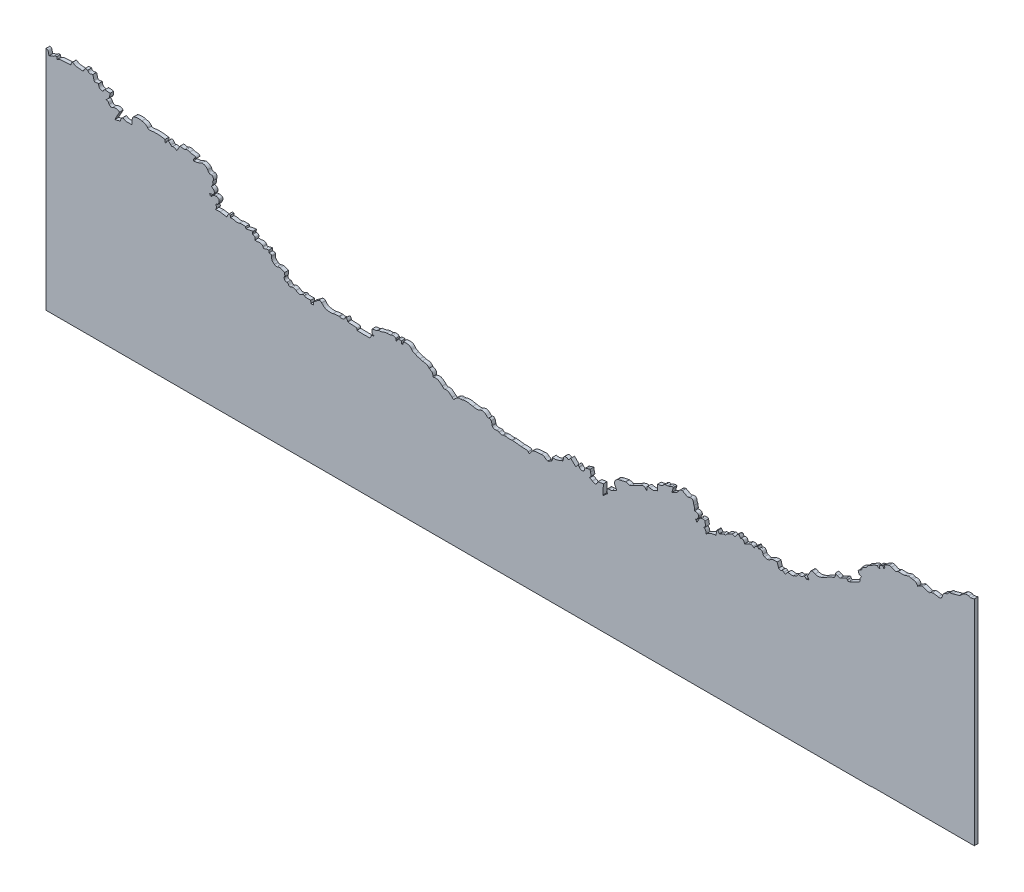
from build123d import *

# Parameters (mm, degrees)
BOSS_EXTRUDE1_DEPTH = 4.7625
SCALE1_SCALE        = 1.25


with BuildPart() as part:
    # Sketch3 → Boss-Extrude1 (new body)
    with BuildSketch(Plane.XY):
        with BuildLine():
            add(Edge.make_bspline(
                [(725.851610967, -198.417629607), (727.334452099, -198.296691726), (728.7855087, -197.784893222), (730.25, -197.439226226)],
                knots=[341, 341, 341, 341, 342, 342, 342, 342], degree=3))
            add(Edge.make_bspline(
                [(730.25, -197.439226226), (730.25, -288.109529826), (730.25, -378.779835131), (730.25, -469.450133611)],
                knots=[0, 0, 0, 0, 1, 1, 1, 1], degree=3))
            add(Edge.make_bspline(
                [(730.25, -469.450133611), (687.377366721, -469.447402981), (644.504624218, -469.442597073), (601.631990939, -469.460919598)],
                knots=[1, 1, 1, 1, 2, 2, 2, 2], degree=3))
            add(Edge.make_bspline(
                [(601.631990939, -469.460919598), (600.95894534, -469.461219967), (600.286118192, -469.745669659), (599.613181818, -469.897519974)],
                knots=[2, 2, 2, 2, 3, 3, 3, 3], degree=3))
            add(Edge.make_bspline(
                [(599.613181818, -469.897519974), (249.458806083, -469.897519974), (-100.695596959, -469.897519974), (-450.849999947, -469.897519974)],
                knots=[3, 3, 3, 3, 4, 4, 4, 4], degree=3))
            add(Edge.make_bspline(
                [(-450.849999947, -469.897519974), (-450.85, -373.709451792), (-450.85, -277.521383611), (-450.85, -181.333315429)],
                knots=[4, 4, 4, 4, 5, 5, 5, 5], degree=3))
            add(Edge.make_bspline(
                [(-450.85, -181.333315429), (-446.851454509, -181.678541684), (-448.116753841, -185.412180685), (-446.995952604, -187.571968802)],
                knots=[5, 5, 5, 5, 6, 6, 6, 6], degree=3))
            add(Edge.make_bspline(
                [(-446.995952604, -187.571968802), (-444.647646935, -185.916783126), (-441.480241967, -186.235297423), (-439.580115397, -183.847361358), (-439.22054011, -183.395474149), (-437.963206323, -183.657951232), (-437.150122089, -183.593198189)],
                knots=[6, 6, 6, 6, 7, 7, 7, 8, 8, 8, 8], degree=3))
            add(Edge.make_bspline(
                [(-437.150122089, -183.593198189), (-436.985577759, -184.749369401), (-436.857178432, -185.651568161), (-436.709741497, -186.687528095)],
                knots=[8, 8, 8, 8, 9, 9, 9, 9], degree=3))
            add(Edge.make_bspline(
                [(-436.709741497, -186.687528095), (-435.054898004, -185.854931805), (-433.730114251, -184.704758592), (-432.304223814, -184.561596372), (-428.011624495, -184.130609146), (-423.679654616, -184.091722847), (-419.418585535, -183.902377999)],
                knots=[9, 9, 9, 9, 10, 10, 10, 11, 11, 11, 11], degree=3))
            add(Edge.make_bspline(
                [(-419.418585535, -183.902377999), (-419.065112352, -182.82868375), (-418.852921948, -182.148742885), (-418.617746468, -181.47684671), (-418.049557049, -179.85352183), (-416.448012033, -179.286698258), (-415.282203832, -180.538390522), (-413.845906284, -182.080494636), (-412.189851073, -182.292094969), (-410.277051822, -182.268728885), (-408.827951034, -182.251027152), (-407.349263874, -182.404904533), (-405.930664219, -182.704552312), (-404.113338021, -183.088422523), (-403.041248443, -182.581793016), (-402.494101938, -180.748965161), (-402.266671207, -179.987111699), (-401.636916328, -179.34536253), (-401.190113636, -178.6489973)],
                knots=[11, 11, 11, 11, 12, 12, 12, 13, 13, 13, 14, 14, 14, 15, 15, 15, 16, 16, 16, 17, 17, 17, 17], degree=3))
            add(Edge.make_bspline(
                [(-401.190113636, -178.6489973), (-399.997084471, -178.648997247), (-398.804051893, -178.648997247), (-397.611022727, -178.648997247)],
                knots=[17, 17, 17, 17, 18, 18, 18, 18], degree=3))
            add(Edge.make_bspline(
                [(-397.611022727, -178.648997247), (-396.418273451, -182.500564463), (-393.56004488, -180.925666127), (-391.261551016, -180.321114746)],
                knots=[18, 18, 18, 18, 19, 19, 19, 19], degree=3))
            add(Edge.make_bspline(
                [(-391.261551016, -180.321114746), (-390.623239026, -182.690028776), (-390.153208916, -184.737976702), (-389.467431757, -186.710926177), (-389.337788287, -187.08390459), (-388.327687416, -187.38323536), (-387.763819218, -187.325583234), (-386.503838426, -187.196758954), (-385.269061347, -186.821389534), (-383.643053303, -186.462325387)],
                knots=[19, 19, 19, 19, 20, 20, 20, 21, 21, 21, 22, 22, 22, 22], degree=3))
            add(Edge.make_bspline(
                [(-383.643053303, -186.462325387), (-384.388767783, -189.689082297), (-382.702563008, -191.460526237), (-380.546212071, -192.212382074), (-377.96762387, -193.111463223), (-377.072380109, -190.059808793), (-375.812522196, -189.332477423)],
                knots=[22, 22, 22, 22, 23, 23, 23, 24, 24, 24, 24], degree=3))
            add(Edge.make_bspline(
                [(-375.812522196, -189.332477423), (-373.38534741, -189.620702211), (-371.475408493, -189.847506604), (-369.403113164, -190.093590949)],
                knots=[24, 24, 24, 24, 25, 25, 25, 25], degree=3))
            add(Edge.make_bspline(
                [(-369.403113164, -190.093590949), (-369.713899779, -191.955510036), (-369.633277938, -194.005920221), (-370.444384173, -195.603621876)],
                knots=[25, 25, 25, 25, 26, 26, 26, 26], degree=3))
            add(Edge.make_bspline(
                [(-370.444384173, -195.603621876), (-371.221357536, -197.134073242), (-372.924314724, -198.194424525), (-374.446278952, -199.682293428)],
                knots=[26, 26, 26, 26, 27, 27, 27, 27], degree=3))
            add(Edge.make_bspline(
                [(-374.446278952, -199.682293428), (-371.660306254, -199.24804822), (-371.573717988, -201.640897285), (-370.547772638, -202.913570384)],
                knots=[27, 27, 27, 27, 28, 28, 28, 28], degree=3))
            add(Edge.make_bspline(
                [(-370.547772638, -202.913570384), (-369.150038407, -204.647429767), (-367.667483992, -205.118772286), (-365.924420681, -203.965461835)],
                knots=[28, 28, 28, 28, 29, 29, 29, 29], degree=3))
            add(Edge.make_bspline(
                [(-365.924420681, -203.965461835), (-363.627906524, -202.445944935), (-359.518459069, -202.835269579), (-357.283711754, -204.857155778)],
                knots=[29, 29, 29, 29, 30, 30, 30, 30], degree=3))
            add(Edge.make_bspline(
                [(-357.283711754, -204.857155778), (-359.260237075, -208.470691873), (-361.250244879, -212.108870195), (-363.392355583, -216.025125601)],
                knots=[30, 30, 30, 30, 31, 31, 31, 31], degree=3))
            add(Edge.make_bspline(
                [(-363.392355583, -216.025125601), (-360.911544403, -215.387844425), (-358.548914875, -214.78091761), (-355.994567838, -214.124743889)],
                knots=[31, 31, 31, 31, 32, 32, 32, 32], degree=3))
            add(Edge.make_bspline(
                [(-355.994567838, -214.124743889), (-355.994567838, -213.632012007), (-356.195651406, -212.943296007), (-355.954495848, -212.489707701), (-355.375854943, -211.401340157), (-354.741195171, -210.257117583), (-353.848647907, -209.442932564), (-352.731322035, -208.423707977), (-351.943118957, -209.542917982), (-351.017230705, -210.184516967), (-350.312926223, -210.672569233), (-349.266262221, -210.806079957), (-348.36241015, -210.839410706), (-346.032391167, -210.925336794), (-343.697095242, -210.868171063), (-341.232108061, -210.868171063)],
                knots=[32, 32, 32, 32, 33, 33, 33, 34, 34, 34, 35, 35, 35, 36, 36, 36, 37, 37, 37, 37], degree=3))
            add(Edge.make_bspline(
                [(-341.232108061, -210.868171063), (-341.232108061, -209.283006411), (-341.232210459, -207.498973416), (-341.232080754, -205.71494042), (-341.231862304, -202.642319873), (-340.185143689, -200.76290257), (-337.123268171, -200.200230729), (-334.451094464, -199.70917477), (-331.42703134, -199.532755615), (-328.895764951, -200.312451075)],
                knots=[37, 37, 37, 37, 38, 38, 38, 39, 39, 39, 40, 40, 40, 40], degree=3))
            add(Edge.make_bspline(
                [(-328.895764951, -200.312451075), (-326.212402489, -201.138992193), (-322.893158299, -201.40169242), (-321.254015926, -204.540493189)],
                knots=[40, 40, 40, 40, 41, 41, 41, 41], degree=3))
            add(Edge.make_bspline(
                [(-321.254015926, -204.540493189), (-320.945632265, -205.131010626), (-319.563838085, -205.567092183), (-318.782850695, -205.437728603), (-314.253200295, -204.687436904), (-309.727645839, -204.519890589), (-305.175467744, -205.05942205), (-303.182285583, -205.295659062), (-301.197322617, -205.60150153), (-299.299930944, -205.863145345)],
                knots=[41, 41, 41, 41, 42, 42, 42, 43, 43, 43, 44, 44, 44, 44], degree=3))
            add(Edge.make_bspline(
                [(-299.299930944, -205.863145345), (-299.202201708, -207.505226557), (-299.130604598, -208.708068923), (-299.059007489, -209.910911289)],
                knots=[44, 44, 44, 44, 45, 45, 45, 45], degree=3))
            add(Edge.make_bspline(
                [(-299.059007489, -209.910911289), (-298.104119949, -209.061835649), (-297.610831701, -208.130015104), (-297.107262632, -207.203788936)],
                knots=[45, 45, 45, 45, 46, 46, 46, 46], degree=3))
            add(Edge.make_bspline(
                [(-297.107262632, -207.203788936), (-296.319721732, -205.755232567), (-294.728761319, -205.415654876), (-293.499431846, -206.517255733), (-292.909042407, -207.046306697), (-292.53102769, -207.806493515), (-291.96799916, -208.373846679)],
                knots=[46, 46, 46, 46, 47, 47, 47, 48, 48, 48, 48], degree=3))
            add(Edge.make_bspline(
                [(-291.96799916, -208.373846679), (-291.521855233, -208.823403893), (-290.685504327, -209.577378529), (-290.458438818, -209.445492529), (-288.236115868, -208.154734129), (-286.480703284, -209.278214156), (-284.410339876, -210.878073008)],
                knots=[48, 48, 48, 48, 49, 49, 49, 50, 50, 50, 50], degree=3))
            add(Edge.make_bspline(
                [(-284.410339876, -210.878073008), (-282.995832752, -208.408662207), (-281.741108423, -206.218192053), (-280.258321904, -203.629570494)],
                knots=[50, 50, 50, 50, 51, 51, 51, 51], degree=3))
            add(Edge.make_bspline(
                [(-280.258321904, -203.629570494), (-279.671318446, -203.775937364), (-278.498813376, -204.205217946), (-277.29501529, -204.328323265), (-276.185464887, -204.441787754), (-274.825624969, -204.594443605), (-273.956834183, -204.082983016)],
                knots=[51, 51, 51, 51, 52, 52, 52, 53, 53, 53, 53], degree=3))
            add(Edge.make_bspline(
                [(-273.956834183, -204.082983016), (-271.828786222, -202.830180368), (-270.029355888, -202.925202866), (-267.877237427, -204.071220829)],
                knots=[53, 53, 53, 53, 54, 54, 54, 54], degree=3))
            add(Edge.make_bspline(
                [(-267.877237427, -204.071220829), (-266.561224116, -204.772018158), (-264.802575736, -205.073672523), (-263.31390471, -204.909442216), (-261.430220798, -204.701637885), (-260.529345114, -205.426539848), (-259.705008978, -207.078412075)],
                knots=[54, 54, 54, 54, 55, 55, 55, 56, 56, 56, 56], degree=3))
            add(Edge.make_bspline(
                [(-259.705008978, -207.078412075), (-262.274995696, -207.335476965), (-262.983143539, -209.059705758), (-263.362591837, -211.518832325)],
                knots=[56, 56, 56, 56, 57, 57, 57, 57], degree=3))
            add(Edge.make_bspline(
                [(-263.362591837, -211.518832325), (-261.414847353, -211.260456733), (-259.567849451, -211.209687501), (-257.839647591, -210.730489302)],
                knots=[57, 57, 57, 57, 58, 58, 58, 58], degree=3))
            add(Edge.make_bspline(
                [(-257.839647591, -210.730489302), (-256.177062763, -210.269480509), (-254.677319034, -209.249436733), (-253.034408392, -208.682612628)],
                knots=[58, 58, 58, 58, 59, 59, 59, 59], degree=3))
            add(Edge.make_bspline(
                [(-253.034408392, -208.682612628), (-250.499291815, -207.807978295), (-246.384383101, -209.697130293), (-245.09140265, -212.298150616)],
                knots=[59, 59, 59, 59, 60, 60, 60, 60], degree=3))
            add(Edge.make_bspline(
                [(-245.09140265, -212.298150616), (-244.130849055, -214.230460216), (-243.356510748, -215.940540934), (-240.50962453, -215.446600748)],
                knots=[60, 60, 60, 60, 61, 61, 61, 61], degree=3))
            add(Edge.make_bspline(
                [(-240.50962453, -215.446600748), (-238.740927433, -215.139736), (-237.045179107, -219.067204055), (-238.078872618, -220.660222679)],
                knots=[61, 61, 61, 61, 62, 62, 62, 62], degree=3))
            add(Edge.make_bspline(
                [(-238.078872618, -220.660222679), (-238.655458724, -221.548824184), (-239.151723359, -222.256101639), (-238.472329046, -223.492329365)],
                knots=[62, 62, 62, 62, 63, 63, 63, 63], degree=3))
            add(Edge.make_bspline(
                [(-238.472329046, -223.492329365), (-238.141799979, -224.093713002), (-238.832103157, -225.353826911), (-239.238775832, -226.233202301)],
                knots=[63, 63, 63, 63, 64, 64, 64, 64], degree=3))
            add(Edge.make_bspline(
                [(-239.238775832, -226.233202301), (-239.593238869, -226.999666153), (-240.198332748, -227.650221604), (-240.855035529, -228.582461983)],
                knots=[64, 64, 64, 64, 65, 65, 65, 65], degree=3))
            add(Edge.make_bspline(
                [(-240.855035529, -228.582461983), (-237.896357332, -229.183753461), (-236.395575964, -231.225622749), (-236.73407847, -233.591348129)],
                knots=[65, 65, 65, 65, 66, 66, 66, 66], degree=3))
            add(Edge.make_bspline(
                [(-236.73407847, -233.591348129), (-237.123712016, -236.314475385), (-239.847160121, -236.759834256), (-243.006799008, -236.893191382)],
                knots=[66, 66, 66, 66, 67, 67, 67, 67], degree=3))
            add(Edge.make_bspline(
                [(-243.006799008, -236.893191382), (-242.351912096, -238.013343455), (-242.078275698, -239.060014283), (-241.444715004, -239.369230786)],
                knots=[67, 67, 67, 67, 68, 68, 68, 68], degree=3))
            add(Edge.make_bspline(
                [(-241.444715004, -239.369230786), (-240.994352254, -239.589025994), (-239.635113075, -238.989393374), (-239.414300707, -238.45351413)],
                knots=[68, 68, 68, 68, 69, 69, 69, 69], degree=3))
            add(Edge.make_bspline(
                [(-239.414300707, -238.45351413), (-238.527351234, -236.301122606), (-236.541391588, -236.215483233), (-234.862928148, -236.068322774)],
                knots=[69, 69, 69, 69, 70, 70, 70, 70], degree=3))
            add(Edge.make_bspline(
                [(-234.862928148, -236.068322774), (-233.621037778, -235.95943209), (-232.069111717, -236.541472628), (-231.088406074, -237.344571291), (-230.480868281, -237.842085189), (-230.409708072, -239.380876922), (-230.594653619, -240.358217063)],
                knots=[70, 70, 70, 70, 71, 71, 71, 72, 72, 72, 72], degree=3))
            add(Edge.make_bspline(
                [(-230.594653619, -240.358217063), (-230.807315057, -241.481925781), (-231.568437115, -242.501836439), (-232.27373145, -243.938318305)],
                knots=[72, 72, 72, 72, 73, 73, 73, 73], degree=3))
            add(Edge.make_bspline(
                [(-232.27373145, -243.938318305), (-232.776590555, -244.091124341), (-233.780451938, -244.396176634), (-234.994394313, -244.765064221)],
                knots=[73, 73, 73, 73, 74, 74, 74, 74], degree=3))
            add(Edge.make_bspline(
                [(-234.994394313, -244.765064221), (-233.967732173, -246.942256689), (-232.843627514, -249.036499454), (-235.415034159, -251.05836688)],
                knots=[74, 74, 74, 74, 75, 75, 75, 75], degree=3))
            add(Edge.make_bspline(
                [(-235.415034159, -251.05836688), (-233.113086048, -251.072627594), (-231.199419823, -250.592569246), (-229.341513055, -250.754031378)],
                knots=[75, 75, 75, 75, 76, 76, 76, 76], degree=3))
            add(Edge.make_bspline(
                [(-229.341513055, -250.754031378), (-226.500552302, -251.000941739), (-223.698038816, -251.690493994), (-220.882814248, -252.191496271)],
                knots=[76, 76, 76, 76, 77, 77, 77, 77], degree=3))
            add(Edge.make_bspline(
                [(-220.882814248, -252.191496271), (-218.750929753, -247.425639578), (-218.750929753, -247.425639578), (-216.403052451, -247.869817452)],
                knots=[77, 77, 77, 77, 78, 78, 78, 78], degree=3))
            add(Edge.make_bspline(
                [(-216.403052451, -247.869817452), (-216.403052451, -248.710967439), (-216.403052451, -249.581464869), (-216.403052451, -250.689267669)],
                knots=[78, 78, 78, 78, 79, 79, 79, 79], degree=3))
            add(Edge.make_bspline(
                [(-216.403052451, -250.689267669), (-214.56577559, -250.689267669), (-212.69177176, -250.227190518), (-211.21452842, -250.795810012), (-208.905125691, -251.684746018), (-207.054878339, -251.638427713), (-204.655037155, -250.85619106)],
                knots=[79, 79, 79, 79, 80, 80, 80, 81, 81, 81, 81], degree=3))
            add(Edge.make_bspline(
                [(-204.655037155, -250.85619106), (-202.308497862, -250.091314386), (-199.517521286, -250.689759182), (-196.851798692, -250.689759182)],
                knots=[81, 81, 81, 81, 82, 82, 82, 82], degree=3))
            add(Edge.make_bspline(
                [(-196.851798692, -250.689759182), (-196.765565407, -251.515808788), (-196.698118855, -252.162135175), (-196.611776345, -252.989283859)],
                knots=[82, 82, 82, 82, 83, 83, 83, 83], degree=3))
            add(Edge.make_bspline(
                [(-196.611776345, -252.989283859), (-193.698331028, -252.405366012), (-190.858640019, -251.836227699), (-187.475389869, -251.158150915)],
                knots=[83, 83, 83, 83, 84, 84, 84, 84], degree=3))
            add(Edge.make_bspline(
                [(-187.475389869, -251.158150915), (-187.946751161, -252.507860197), (-188.260500509, -253.097744469), (-188.329694665, -253.715057917)],
                knots=[84, 84, 84, 84, 85, 85, 85, 85], degree=3))
            add(Edge.make_bspline(
                [(-188.329694665, -253.715057917), (-188.37434046, -254.113211027), (-188.159139536, -254.836049658), (-187.892056649, -254.928836454)],
                knots=[85, 85, 85, 85, 86, 86, 86, 86], degree=3))
            add(Edge.make_bspline(
                [(-187.892056649, -254.928836454), (-184.420006423, -256.134989708), (-184.412415272, -256.113110538), (-185.140291914, -259.768386015)],
                knots=[86, 86, 86, 86, 87, 87, 87, 87], degree=3))
            add(Edge.make_bspline(
                [(-185.140291914, -259.768386015), (-183.664250051, -259.768386015), (-182.240909341, -259.97999616), (-180.906423319, -259.725549262), (-177.868242839, -259.146259832), (-175.730979004, -259.593052284), (-174.832410701, -261.707740639)],
                knots=[87, 87, 87, 87, 88, 88, 88, 89, 89, 89, 89], degree=3))
            add(Edge.make_bspline(
                [(-174.832410701, -261.707740639), (-173.909730939, -263.87926705), (-172.73662513, -263.189646529), (-171.233249664, -262.591072028), (-170.023034599, -262.109218291), (-168.669079188, -261.988456195), (-167.175970889, -261.663299641)],
                knots=[89, 89, 89, 89, 90, 90, 90, 91, 91, 91, 91], degree=3))
            add(Edge.make_bspline(
                [(-167.175970889, -261.663299641), (-167.248250656, -263.107857344), (-167.293524496, -264.013252221), (-167.338061066, -264.903833432)],
                knots=[91, 91, 91, 91, 92, 92, 92, 92], degree=3))
            add(Edge.make_bspline(
                [(-167.338061066, -264.903833432), (-165.911225149, -265.287220663), (-163.45294849, -264.183718604), (-163.714488199, -266.861257998)],
                knots=[92, 92, 92, 92, 93, 93, 93, 93], degree=3))
            add(Edge.make_bspline(
                [(-163.714488199, -266.861257998), (-164.02608035, -270.051807613), (-163.164839755, -272.371668654), (-160.326787123, -273.89909414)],
                knots=[93, 93, 93, 93, 94, 94, 94, 94], degree=3))
            add(Edge.make_bspline(
                [(-160.326787123, -273.89909414), (-159.023102604, -275.640170918), (-157.680752369, -275.47991709), (-156.081204126, -274.720843004)],
                knots=[94, 94, 94, 94, 95, 95, 95, 95], degree=3))
            add(Edge.make_bspline(
                [(-156.081204126, -274.720843004), (-155.24740636, -274.325154286), (-154.118782508, -274.098682689), (-153.25262678, -274.314573096)],
                knots=[95, 95, 95, 95, 96, 96, 96, 96], degree=3))
            add(Edge.make_bspline(
                [(-153.25262678, -274.314573096), (-151.262980784, -274.810462269), (-149.352550354, -275.624278654), (-147.142324094, -276.403395562)],
                knots=[96, 96, 96, 96, 97, 97, 97, 97], degree=3))
            add(Edge.make_bspline(
                [(-147.142324094, -276.403395562), (-147.539767241, -278.086125611), (-146.158423615, -280.432699036), (-148.116203162, -282.457604288)],
                knots=[97, 97, 97, 97, 98, 98, 98, 98], degree=3))
            add(Edge.make_bspline(
                [(-148.116203162, -282.457604288), (-147.47319449, -284.187444525), (-146.89268993, -286.175732033), (-144.129756921, -285.635408688)],
                knots=[98, 98, 98, 98, 99, 99, 99, 99], degree=3))
            add(Edge.make_bspline(
                [(-144.129756921, -285.635408688), (-143.828131568, -285.576427088), (-143.38181015, -286.205605121), (-143.016998027, -286.531690089)],
                knots=[99, 99, 99, 99, 100, 100, 100, 100], degree=3))
            add(Edge.make_bspline(
                [(-143.016998027, -286.531690089), (-142.009422989, -287.432354149), (-141.635244806, -289.679047969), (-139.666979641, -288.622785803)],
                knots=[100, 100, 100, 100, 101, 101, 101, 101], degree=3))
            add(Edge.make_bspline(
                [(-139.666979641, -288.622785803), (-137.247532536, -287.324419185), (-135.097680498, -287.261116363), (-132.768125721, -288.953123726)],
                knots=[101, 101, 101, 101, 102, 102, 102, 102], degree=3))
            add(Edge.make_bspline(
                [(-132.768125721, -288.953123726), (-129.208258445, -291.538688686), (-128.106558602, -291.526721702), (-124.565969571, -289.327793422)],
                knots=[102, 102, 102, 102, 103, 103, 103, 103], degree=3))
            add(Edge.make_bspline(
                [(-124.565969571, -289.327793422), (-123.923425106, -288.928739204), (-122.410710886, -288.832231925), (-122.068808746, -289.24035866)],
                knots=[103, 103, 103, 103, 104, 104, 104, 104], degree=3))
            add(Edge.make_bspline(
                [(-122.068808746, -289.24035866), (-120.684816409, -290.892355472), (-118.945596459, -290.469449204), (-117.254817879, -290.500366758), (-116.230476775, -290.519098878), (-115.205534932, -290.503821004), (-114.09807346, -290.503821004)],
                knots=[104, 104, 104, 104, 105, 105, 105, 106, 106, 106, 106], degree=3))
            add(Edge.make_bspline(
                [(-114.09807346, -290.503821004), (-114.006897736, -291.78959942), (-113.93054933, -292.866457359), (-113.849722692, -294.006604468)],
                knots=[106, 106, 106, 106, 107, 107, 107, 107], degree=3))
            add(Edge.make_bspline(
                [(-113.849722692, -294.006604468), (-112.538610861, -294.006604468), (-111.365095458, -294.006604468), (-110.160478183, -294.006604468)],
                knots=[107, 107, 107, 107, 108, 108, 108, 108], degree=3))
            add(Edge.make_bspline(
                [(-110.160478183, -294.006604468), (-110.396786874, -292.599982037), (-110.622555334, -291.256170915), (-110.75692962, -290.456355834)],
                knots=[108, 108, 108, 108, 109, 109, 109, 109], degree=3))
            add(Edge.make_bspline(
                [(-110.75692962, -290.456355834), (-108.488486335, -288.819179515), (-106.467165035, -287.476412859), (-104.582511749, -285.963370964), (-103.075094951, -284.753183204), (-101.169224673, -284.854039011), (-99.973509251, -286.309068679)],
                knots=[109, 109, 109, 109, 110, 110, 110, 111, 111, 111, 111], degree=3))
            add(Edge.make_bspline(
                [(-99.973509251, -286.309068679), (-97.929387193, -288.796508462), (-95.659715125, -290.775354818), (-92.125051561, -291.036082165), (-89.993877029, -291.193284514), (-88.060563923, -291.835084883), (-85.785457902, -291.070235515)],
                knots=[111, 111, 111, 111, 112, 112, 112, 113, 113, 113, 113], degree=3))
            add(Edge.make_bspline(
                [(-85.785457902, -291.070235515), (-83.419886121, -290.274966933), (-80.751951717, -290.373044323), (-78.213394546, -290.107476936)],
                knots=[113, 113, 113, 113, 114, 114, 114, 114], degree=3))
            add(Edge.make_bspline(
                [(-78.213394546, -290.107476936), (-77.954585467, -290.080409569), (-77.653533547, -290.193635128), (-77.410889795, -290.31767398)],
                knots=[114, 114, 114, 114, 115, 115, 115, 115], degree=3))
            add(Edge.make_bspline(
                [(-77.410889795, -290.31767398), (-75.44601061, -291.322067836), (-72.310537796, -290.752287824), (-70.866034705, -289.111500247)],
                knots=[115, 115, 115, 115, 116, 116, 116, 116], degree=3))
            add(Edge.make_bspline(
                [(-70.866034705, -289.111500247), (-68.763367948, -286.723093575), (-68.368791962, -286.798520393), (-67.096100089, -289.855228194)],
                knots=[116, 116, 116, 116, 117, 117, 117, 117], degree=3))
            add(Edge.make_bspline(
                [(-67.096100089, -289.855228194), (-66.96227193, -290.176582346), (-66.898894015, -290.527256634), (-66.833222372, -290.757633031)],
                knots=[117, 117, 117, 117, 118, 118, 118, 118], degree=3))
            add(Edge.make_bspline(
                [(-66.833222372, -290.757633031), (-63.916036093, -290.977332667), (-61.113126665, -291.410130642), (-58.324908024, -291.33013002), (-55.980607848, -291.262867784), (-54.961454939, -291.926485884), (-55.33211061, -294.314878903)],
                knots=[118, 118, 118, 118, 119, 119, 119, 120, 120, 120, 120], degree=3))
            add(Edge.make_bspline(
                [(-55.33211061, -294.314878903), (-49.786256381, -294.526721152), (-44.528210519, -294.587696113), (-39.275598609, -294.445580492), (-38.654899181, -294.42878712), (-37.6189529, -293.348672904), (-37.543560215, -292.675477121)],
                knots=[120, 120, 120, 120, 121, 121, 121, 122, 122, 122, 122], degree=3))
            add(Edge.make_bspline(
                [(-37.543560215, -292.675477121), (-37.321505411, -290.692248104), (-36.33776877, -289.983096755), (-34.488777507, -290.035695509), (-34.141277577, -290.045580388), (-33.787032991, -289.818002885), (-33.230339522, -289.6309411)],
                knots=[122, 122, 122, 122, 123, 123, 123, 124, 124, 124, 124], degree=3))
            add(Edge.make_bspline(
                [(-33.230339522, -289.6309411), (-36.194847613, -288.252922016), (-36.445601335, -287.597891746), (-35.933881337, -283.017656431)],
                knots=[124, 124, 124, 124, 125, 125, 125, 125], degree=3))
            add(Edge.make_bspline(
                [(-35.933881337, -283.017656431), (-33.269278301, -282.100738297), (-29.900691632, -283.074405742), (-27.822027109, -280.308100405)],
                knots=[125, 125, 125, 125, 126, 126, 126, 126], degree=3))
            add(Edge.make_bspline(
                [(-27.822027109, -280.308100405), (-23.727994059, -281.128176758), (-20.80556497, -278.352798903), (-17.35205572, -278.202307076)],
                knots=[126, 126, 126, 126, 127, 127, 127, 127], degree=3))
            add(Edge.make_bspline(
                [(-17.35205572, -278.202307076), (-15.725774612, -278.131447236), (-13.779217952, -278.578860906), (-12.541587365, -277.843072264)],
                knots=[127, 127, 127, 127, 128, 128, 128, 128], degree=3))
            add(Edge.make_bspline(
                [(-12.541587365, -277.843072264), (-9.970098801, -276.314274636), (-7.942770115, -277.070809237), (-5.775442047, -278.342497603)],
                knots=[128, 128, 128, 128, 129, 129, 129, 129], degree=3))
            add(Edge.make_bspline(
                [(-5.775442047, -278.342497603), (-5.720911373, -279.06703605), (-5.666408005, -279.790550512), (-5.611904637, -280.514064974)],
                knots=[129, 129, 129, 129, 130, 130, 130, 130], degree=3))
            add(Edge.make_bspline(
                [(-5.611904637, -280.514064974), (-5.428242486, -280.641592205), (-5.244607641, -280.769126264), (-5.06094549, -280.896660322)],
                knots=[130, 130, 130, 130, 131, 131, 131, 131], degree=3))
            add(Edge.make_bspline(
                [(-5.06094549, -280.896660322), (-4.675052906, -280.442522476), (-3.993378518, -280.010646089), (-3.957224981, -279.530198627)],
                knots=[131, 131, 131, 131, 132, 132, 132, 132], degree=3))
            add(Edge.make_bspline(
                [(-3.957224981, -279.530198627), (-3.835029304, -277.906730068), (-3.067667756, -277.356453579), (-1.520138009, -277.512379359)],
                knots=[132, 132, 132, 132, 133, 133, 133, 133], degree=3))
            add(Edge.make_bspline(
                [(-1.520138009, -277.512379359), (-0.585798458, -277.606517817), (0.365716754, -277.529698378), (1.336947112, -277.529698378)],
                knots=[133, 133, 133, 133, 134, 134, 134, 134], degree=3))
            add(Edge.make_bspline(
                [(1.336947112, -277.529698378), (1.433747933, -278.724253283), (1.509222537, -279.655397997), (1.594773164, -280.71108673)],
                knots=[134, 134, 134, 134, 135, 135, 135, 135], degree=3))
            add(Edge.make_bspline(
                [(1.594773164, -280.71108673), (2.39790596, -280.623727061), (3.020817198, -280.555966486), (3.640397068, -280.488567719)],
                knots=[135, 135, 135, 135, 136, 136, 136, 136], degree=3))
            add(Edge.make_bspline(
                [(3.640397068, -280.488567719), (3.693098221, -279.286571849), (3.737662097, -278.270224662), (3.786567674, -277.15497407)],
                knots=[136, 136, 136, 136, 137, 137, 137, 137], degree=3))
            add(Edge.make_bspline(
                [(3.786567674, -277.15497407), (7.857772661, -277.044328956), (11.837883842, -276.19913081), (14.463111198, -280.57823477), (15.23478714, -281.865460419), (17.112968833, -282.618895755), (18.626720692, -283.299785088)],
                knots=[137, 137, 137, 137, 138, 138, 138, 139, 139, 139, 139], degree=3))
            add(Edge.make_bspline(
                [(18.626720692, -283.299785088), (20.64400066, -284.207207457), (22.796774472, -284.816581599), (24.899413924, -285.530183874)],
                knots=[139, 139, 139, 139, 140, 140, 140, 140], degree=3))
            add(Edge.make_bspline(
                [(24.899413924, -285.530183874), (25.912477528, -285.873997455), (26.925759583, -286.257917159), (27.970607716, -286.45951272)],
                knots=[140, 140, 140, 140, 141, 141, 141, 141], degree=3))
            add(Edge.make_bspline(
                [(27.970607716, -286.45951272), (31.083252466, -287.060060101), (34.701282154, -286.472257934), (36.41251315, -290.225781466)],
                knots=[141, 141, 141, 141, 142, 142, 142, 142], degree=3))
            add(Edge.make_bspline(
                [(36.41251315, -290.225781466), (36.483345684, -290.381126987), (36.769515672, -290.46359883), (36.971800717, -290.529871211)],
                knots=[142, 142, 142, 142, 143, 143, 143, 143], degree=3))
            add(Edge.make_bspline(
                [(36.971800717, -290.529871211), (40.102686074, -291.555830214), (41.92701975, -293.482869699), (41.237754211, -297.001504467)],
                knots=[143, 143, 143, 143, 144, 144, 144, 144], degree=3))
            add(Edge.make_bspline(
                [(41.237754211, -297.001504467), (41.656032063, -297.103957692), (41.857989433, -297.174339671), (42.065298836, -297.198505744)],
                knots=[144, 144, 144, 144, 145, 145, 145, 145], degree=3))
            add(Edge.make_bspline(
                [(42.065298836, -297.198505744), (42.286042938, -297.224228275), (42.535294814, -297.270048241), (42.7321186, -297.197932312), (47.420336664, -295.480175111), (50.450024886, -298.688746881), (53.311397095, -301.279786754)],
                knots=[145, 145, 145, 145, 146, 146, 146, 147, 147, 147, 147], degree=3))
            add(Edge.make_bspline(
                [(53.311397095, -301.279786754), (54.464869676, -302.324320865), (55.201429721, -303.306610273), (56.737791193, -303.010309649)],
                knots=[147, 147, 147, 147, 148, 148, 148, 148], degree=3))
            add(Edge.make_bspline(
                [(56.737791193, -303.010309649), (60.919204393, -302.203859138), (63.345805747, -305.140432888), (65.918331951, -307.445179893)],
                knots=[148, 148, 148, 148, 149, 149, 149, 149], degree=3))
            add(Edge.make_bspline(
                [(65.918331951, -307.445179893), (67.819232483, -309.148232653), (67.719455275, -309.284436461), (69.572078275, -307.327394183)],
                knots=[149, 149, 149, 149, 150, 150, 150, 150], degree=3))
            add(Edge.make_bspline(
                [(69.572078275, -307.327394183), (71.447365501, -305.346363323), (73.536351804, -303.557596098), (76.619287304, -303.911513009)],
                knots=[150, 150, 150, 150, 151, 151, 151, 151], degree=3))
            add(Edge.make_bspline(
                [(76.619287304, -303.911513009), (77.353826682, -303.995848506), (78.207694577, -304.134605452), (78.837760065, -303.860381968)],
                knots=[151, 151, 151, 151, 152, 152, 152, 152], degree=3))
            add(Edge.make_bspline(
                [(78.837760065, -303.860381968), (83.393105691, -301.877644465), (87.820876298, -303.508635908), (92.30244031, -304.148927605)],
                knots=[152, 152, 152, 152, 153, 153, 153, 153], degree=3))
            add(Edge.make_bspline(
                [(92.30244031, -304.148927605), (95.160481151, -304.557252311), (98.01721129, -305.621829244), (100.926970256, -304.079992859)],
                knots=[153, 153, 153, 153, 154, 154, 154, 154], degree=3))
            add(Edge.make_bspline(
                [(100.926970256, -304.079992859), (104.440089153, -302.218427047), (107.336522647, -302.991604835), (109.969778054, -306.112195718), (110.490836806, -306.729686656), (111.741847479, -307.554063751), (112.105676575, -307.341361354)],
                knots=[154, 154, 154, 154, 155, 155, 155, 156, 156, 156, 156], degree=3))
            add(Edge.make_bspline(
                [(112.105676575, -307.341361354), (113.835585077, -306.329977087), (114.924560186, -307.507506515), (115.572320154, -308.486710312)],
                knots=[156, 156, 156, 156, 157, 157, 157, 157], degree=3))
            add(Edge.make_bspline(
                [(115.572320154, -308.486710312), (116.285888297, -309.565377293), (116.324390176, -311.091321414), (116.653157987, -312.423363522)],
                knots=[157, 157, 157, 157, 158, 158, 158, 158], degree=3))
            add(Edge.make_bspline(
                [(116.653157987, -312.423363522), (116.72546506, -312.716373737), (116.705258401, -313.062112412), (116.857409085, -313.300865016)],
                knots=[158, 158, 158, 158, 159, 159, 159, 159], degree=3))
            add(Edge.make_bspline(
                [(116.857409085, -313.300865016), (118.282743156, -315.537305321), (119.778145183, -316.007287645), (122.552191856, -315.469886075)],
                knots=[159, 159, 159, 159, 160, 160, 160, 160], degree=3))
            add(Edge.make_bspline(
                [(122.552191856, -315.469886075), (123.541608207, -315.278223179), (125.087581496, -315.192399489), (125.590672705, -315.758854959)],
                knots=[160, 160, 160, 160, 161, 161, 161, 161], degree=3))
            add(Edge.make_bspline(
                [(125.590672705, -315.758854959), (127.328882321, -317.71591089), (129.069549505, -317.519073451), (131.117521751, -316.54878516)],
                knots=[161, 161, 161, 161, 162, 162, 162, 162], degree=3))
            add(Edge.make_bspline(
                [(131.117521751, -316.54878516), (131.611164981, -316.314920383), (132.299884394, -316.531937175), (132.883693015, -316.44253636)],
                knots=[162, 162, 162, 162, 163, 163, 163, 163], degree=3))
            add(Edge.make_bspline(
                [(132.883693015, -316.44253636), (135.969195307, -315.969987244), (139.045577295, -317.748541914), (142.138397674, -316.471562953)],
                knots=[163, 163, 163, 163, 164, 164, 164, 164], degree=3))
            add(Edge.make_bspline(
                [(142.138397674, -316.471562953), (142.38300748, -316.370556962), (142.723899286, -316.48850651), (143.017824263, -316.523308385)],
                knots=[164, 164, 164, 164, 165, 165, 165, 165], degree=3))
            add(Edge.make_bspline(
                [(143.017824263, -316.523308385), (146.578073828, -316.944972218), (150.130786854, -317.450357155), (153.700484397, -317.762945986)],
                knots=[165, 165, 165, 165, 166, 166, 166, 166], degree=3))
            add(Edge.make_bspline(
                [(153.700484397, -317.762945986), (155.698158444, -317.937883775), (157.738266477, -317.651549949), (159.730697715, -317.854108057), (160.75768753, -317.958513682), (162.165545571, -318.409654662), (162.626421245, -319.172346832)],
                knots=[166, 166, 166, 166, 167, 167, 167, 168, 168, 168, 168], degree=3))
            add(Edge.make_bspline(
                [(162.626421245, -319.172346832), (163.725281233, -320.990864267), (164.381396928, -320.652361761), (165.37987897, -319.209032842)],
                knots=[168, 168, 168, 168, 169, 169, 169, 169], degree=3))
            add(Edge.make_bspline(
                [(165.37987897, -319.209032842), (166.365090152, -317.784722757), (167.201864305, -315.869977933), (168.596233035, -315.208564816)],
                knots=[169, 169, 169, 169, 170, 170, 170, 170], degree=3))
            add(Edge.make_bspline(
                [(168.596233035, -315.208564816), (170.622633306, -314.24731491), (173.080363839, -314.142335853), (175.374911943, -313.820285391), (176.629308596, -313.644228043), (178.0083858, -314.049699242), (179.185724085, -313.701202631)],
                knots=[170, 170, 170, 170, 171, 171, 171, 172, 172, 172, 172], degree=3))
            add(Edge.make_bspline(
                [(179.185724085, -313.701202631), (181.104264485, -313.133286274), (182.528451691, -313.544915042), (183.988956271, -314.813620195), (185.017256789, -315.706877423), (186.345271218, -316.93422719), (187.471328278, -316.867244845)],
                knots=[172, 172, 172, 172, 173, 173, 173, 174, 174, 174, 174], degree=3))
            add(Edge.make_bspline(
                [(187.471328278, -316.867244845), (188.941280837, -316.779823736), (190.328167641, -315.527570627), (191.779442694, -314.836734976)],
                knots=[174, 174, 174, 174, 175, 175, 175, 175], degree=3))
            add(Edge.make_bspline(
                [(191.779442694, -314.836734976), (193.790387601, -313.879512748), (193.29483293, -311.951415144), (193.577616938, -309.763552741)],
                knots=[175, 175, 175, 175, 176, 176, 176, 176], degree=3))
            add(Edge.make_bspline(
                [(193.577616938, -309.763552741), (197.695078791, -310.982301025), (201.215133487, -309.364990036), (204.683524669, -307.532082182)],
                knots=[176, 176, 176, 176, 177, 177, 177, 177], degree=3))
            add(Edge.make_bspline(
                [(204.683524669, -307.532082182), (206.89123875, -307.746791592), (207.237427979, -306.687894369), (207.2795889, -305.247719327)],
                knots=[177, 177, 177, 177, 178, 178, 178, 178], degree=3))
            add(Edge.make_bspline(
                [(207.2795889, -305.247719327), (207.30274464, -304.45815776), (207.346980841, -303.613273637), (207.638175188, -302.897684828), (208.639442472, -300.4371554), (210.200270386, -300.082692364), (214.184477511, -302.167541763)],
                knots=[178, 178, 178, 178, 179, 179, 179, 180, 180, 180, 180], degree=3))
            add(Edge.make_bspline(
                [(214.184477511, -302.167541763), (214.960249398, -301.278735462), (215.762289942, -300.359810315), (216.843837738, -299.120718841)],
                knots=[180, 180, 180, 180, 181, 181, 181, 181], degree=3))
            add(Edge.make_bspline(
                [(216.843837738, -299.120718841), (219.053190197, -301.271308149), (221.185156611, -303.346532079), (223.219584933, -305.326812015)],
                knots=[181, 181, 181, 181, 182, 182, 182, 182], degree=3))
            add(Edge.make_bspline(
                [(223.219584933, -305.326812015), (223.624646537, -304.760301932), (224.167768777, -303.983669898), (224.728476271, -303.2199947)],
                knots=[182, 182, 182, 182, 183, 183, 183, 183], degree=3))
            add(Edge.make_bspline(
                [(224.728476271, -303.2199947), (225.737607769, -301.845450341), (226.560510323, -301.219248694), (227.580291276, -303.353754594)],
                knots=[183, 183, 183, 183, 184, 184, 184, 184], degree=3))
            add(Edge.make_bspline(
                [(227.580291276, -303.353754594), (228.493905348, -305.266137424), (230.612218614, -305.551105935), (232.370962566, -305.348875503)],
                knots=[184, 184, 184, 184, 185, 185, 185, 185], degree=3))
            add(Edge.make_bspline(
                [(232.370962566, -305.348875503), (233.187202384, -305.254996455), (234.32729488, -303.695602121), (234.439906047, -302.700861042)],
                knots=[185, 185, 185, 185, 186, 186, 186, 186], degree=3))
            add(Edge.make_bspline(
                [(234.439906047, -302.700861042), (234.643447182, -300.902796023), (235.580708507, -300.515442553), (237.022044067, -300.328298849)],
                knots=[186, 186, 186, 186, 187, 187, 187, 187], degree=3))
            add(Edge.make_bspline(
                [(237.022044067, -300.328298849), (237.501051123, -300.266095105), (237.949748188, -299.987434348), (238.418324238, -299.825084762)],
                knots=[187, 187, 187, 187, 188, 188, 188, 188], degree=3))
            add(Edge.make_bspline(
                [(238.418324238, -299.825084762), (239.422977503, -299.477011399), (240.431508262, -299.140215537), (241.556964583, -298.758637348)],
                knots=[188, 188, 188, 188, 189, 189, 189, 189], degree=3))
            add(Edge.make_bspline(
                [(241.556964583, -298.758637348), (241.677166901, -300.195098734), (241.656960241, -301.096930139), (241.843626085, -301.953678848)],
                knots=[189, 189, 189, 189, 190, 190, 190, 190], degree=3))
            add(Edge.make_bspline(
                [(241.843626085, -301.953678848), (242.27861539, -303.949482414), (243.769976085, -306.003052451), (241.227541421, -307.712208168)],
                knots=[190, 190, 190, 190, 191, 191, 191, 191], degree=3))
            add(Edge.make_bspline(
                [(241.227541421, -307.712208168), (240.914283586, -307.922780674), (240.908221588, -308.590201176), (240.851260653, -308.765125312)],
                knots=[191, 191, 191, 191, 192, 192, 192, 192], degree=3))
            add(Edge.make_bspline(
                [(240.851260653, -308.765125312), (242.181678037, -309.360197781), (243.444648868, -309.687982565), (244.419811332, -310.406342963)],
                knots=[192, 192, 192, 192, 193, 193, 193, 193], degree=3))
            add(Edge.make_bspline(
                [(244.419811332, -310.406342963), (247.18681298, -312.444621474), (249.382075389, -312.370061631), (250.67136949, -309.100159918)],
                knots=[193, 193, 193, 193, 194, 194, 194, 194], degree=3))
            add(Edge.make_bspline(
                [(250.67136949, -309.100159918), (250.893861195, -308.53601183), (251.238903559, -307.68277198), (251.662041931, -307.592183341), (253.762169203, -307.142571514), (255.907351865, -306.903736991), (258.357491247, -306.543457714)],
                knots=[194, 194, 194, 194, 195, 195, 195, 196, 196, 196, 196], degree=3))
            add(Edge.make_bspline(
                [(258.357491247, -306.543457714), (258.163234253, -310.843844448), (257.978316012, -314.936962737), (257.793452384, -319.03009468)],
                knots=[196, 196, 196, 196, 197, 197, 197, 197], degree=3))
            add(Edge.make_bspline(
                [(257.793452384, -319.03009468), (258.016217152, -319.171418418), (258.23898192, -319.312742156), (258.461746687, -319.454065894)],
                knots=[197, 197, 197, 197, 198, 198, 198, 198], degree=3))
            add(Edge.make_bspline(
                [(258.461746687, -319.454065894), (259.739135243, -318.231917977), (260.864810014, -316.762566156), (262.337657041, -315.859014455)],
                knots=[198, 198, 198, 198, 199, 199, 199, 199], degree=3))
            add(Edge.make_bspline(
                [(262.337657041, -315.859014455), (263.733664148, -315.002566115), (263.698384413, -314.298923811), (263.132379497, -313.025481015), (262.011073733, -310.502665925), (263.225603194, -308.776880673), (265.939248338, -308.842907298)],
                knots=[199, 199, 199, 199, 200, 200, 200, 201, 201, 201, 201], degree=3))
            add(Edge.make_bspline(
                [(265.939248338, -308.842907298), (266.791314017, -308.86364643), (267.752058757, -309.087858432), (268.477368608, -308.780676248), (270.7280628, -307.827454393), (272.889520014, -306.663619072), (275.310113983, -305.470907342)],
                knots=[201, 201, 201, 201, 202, 202, 202, 203, 203, 203, 203], degree=3))
            add(Edge.make_bspline(
                [(275.310113983, -305.470907342), (275.000132904, -304.808251789), (274.52325574, -303.928060624), (274.168983848, -303.001052814)],
                knots=[203, 203, 203, 203, 204, 204, 204, 204], degree=3))
            add(Edge.make_bspline(
                [(274.168983848, -303.001052814), (273.542195115, -301.360613392), (272.356337266, -299.618922222), (272.536449599, -298.049588397)],
                knots=[204, 204, 204, 204, 205, 205, 205, 205], degree=3))
            add(Edge.make_bspline(
                [(272.536449599, -298.049588397), (272.927803442, -294.640479184), (276.149946442, -292.303640453), (279.610801086, -291.801723415)],
                knots=[205, 205, 205, 205, 206, 206, 206, 206], degree=3))
            add(Edge.make_bspline(
                [(279.610801086, -291.801723415), (281.966569907, -291.460087512), (284.261008786, -290.696016373), (286.815512834, -290.063220256)],
                knots=[206, 206, 206, 206, 207, 207, 207, 207], degree=3))
            add(Edge.make_bspline(
                [(286.815512834, -290.063220256), (288.152538341, -290.4352822), (289.885778212, -291.011813694), (291.663581959, -291.363791857)],
                knots=[207, 207, 207, 207, 208, 208, 208, 208], degree=3))
            add(Edge.make_bspline(
                [(291.663581959, -291.363791857), (292.331384749, -291.495995292), (293.184105779, -291.261823319), (293.813079015, -290.930195173)],
                knots=[208, 208, 208, 208, 209, 209, 209, 209], degree=3))
            add(Edge.make_bspline(
                [(293.813079015, -290.930195173), (297.715367251, -288.872658897), (301.504115906, -286.586555265), (305.473741469, -284.673448818)],
                knots=[209, 209, 209, 209, 210, 210, 210, 210], degree=3))
            add(Edge.make_bspline(
                [(305.473741469, -284.673448818), (309.801188743, -282.587944068), (311.001518929, -282.958162838), (312.95588519, -286.135619083)],
                knots=[210, 210, 210, 210, 211, 211, 211, 211], degree=3))
            add(Edge.make_bspline(
                [(312.95588519, -286.135619083), (312.990618799, -286.192184076), (313.19765514, -286.142746026), (313.626691673, -286.142746026)],
                knots=[211, 211, 211, 211, 212, 212, 212, 212], degree=3))
            add(Edge.make_bspline(
                [(313.626691673, -286.142746026), (313.663773623, -285.475025155), (313.727670357, -284.775123814), (313.737227561, -284.074471549)],
                knots=[212, 212, 212, 212, 213, 213, 213, 213], degree=3))
            add(Edge.make_bspline(
                [(313.737227561, -284.074471549), (313.777149367, -281.145140794), (314.262546095, -280.861530771), (317.247342765, -281.484926696)],
                knots=[213, 213, 213, 213, 214, 214, 214, 214], degree=3))
            add(Edge.make_bspline(
                [(317.247342765, -281.484926696), (318.887085877, -281.827402268), (320.643372262, -282.102165051), (322.270008351, -281.869112636), (323.689498874, -281.665735339), (325.000965687, -280.707980639), (326.360163907, -280.083519768)],
                knots=[214, 214, 214, 214, 215, 215, 215, 216, 216, 216, 216], degree=3))
            add(Edge.make_bspline(
                [(326.360163907, -280.083519768), (326.598384039, -280.211948108), (326.836658783, -280.340369621), (327.074878915, -280.468791134)],
                knots=[216, 216, 216, 216, 217, 217, 217, 217], degree=3))
            add(Edge.make_bspline(
                [(327.074878915, -280.468791134), (327.074878915, -277.942139508), (327.074878915, -275.415487883), (327.074878915, -272.668904519)],
                knots=[217, 217, 217, 217, 218, 218, 218, 218], degree=3))
            add(Edge.make_bspline(
                [(327.074878915, -272.668904519), (327.689325201, -272.539616031), (328.617466223, -272.396647088), (329.514478066, -272.143360708), (330.880721311, -271.757584176), (332.63203795, -271.685352194), (333.495135373, -270.785159167)],
                knots=[218, 218, 218, 218, 219, 219, 219, 220, 220, 220, 220], degree=3))
            add(Edge.make_bspline(
                [(333.495135373, -270.785159167), (335.336781242, -268.86446157), (337.029553181, -267.292581432), (339.935598491, -268.094342087)],
                knots=[220, 220, 220, 220, 221, 221, 221, 221], degree=3))
            add(Edge.make_bspline(
                [(339.935598491, -268.094342087), (340.37867046, -268.216578724), (340.982794966, -267.861863104), (341.48179023, -267.654144106)],
                knots=[221, 221, 221, 221, 222, 222, 222, 222], degree=3))
            add(Edge.make_bspline(
                [(341.48179023, -267.654144106), (342.810132335, -267.101293998), (344.094784366, -266.426814819), (345.455293288, -265.977988048)],
                knots=[222, 222, 222, 222, 223, 223, 223, 223], degree=3))
            add(Edge.make_bspline(
                [(345.455293288, -265.977988048), (345.896945329, -265.832281649), (346.713512823, -266.080857694), (346.996952182, -266.436986414)],
                knots=[223, 223, 223, 223, 224, 224, 224, 224], degree=3))
            add(Edge.make_bspline(
                [(346.996952182, -266.436986414), (347.216112518, -266.712295323), (346.901980882, -267.444561453), (346.770746821, -267.95985175)],
                knots=[224, 224, 224, 224, 225, 225, 225, 225], degree=3))
            add(Edge.make_bspline(
                [(346.770746821, -267.95985175), (346.432640256, -269.287702341), (346.064496765, -270.60788669), (345.560149467, -272.481624283)],
                knots=[225, 225, 225, 225, 226, 226, 226, 226], degree=3))
            add(Edge.make_bspline(
                [(345.560149467, -272.481624283), (346.844965335, -271.842069857), (347.387049935, -271.439397554), (347.991010604, -271.294066617)],
                knots=[226, 226, 226, 226, 227, 227, 227, 227], degree=3))
            add(Edge.make_bspline(
                [(347.991010604, -271.294066617), (350.967451546, -270.577918029), (352.820566059, -268.486235229), (354.384561504, -266.089083716)],
                knots=[227, 227, 227, 227, 228, 228, 228, 228], degree=3))
            add(Edge.make_bspline(
                [(354.384561504, -266.089083716), (355.16284557, -264.896146709), (357.821714283, -263.374598903), (358.887042139, -263.894783853)],
                knots=[228, 228, 228, 228, 229, 229, 229, 229], degree=3))
            add(Edge.make_bspline(
                [(358.887042139, -263.894783853), (360.949104434, -264.901621622), (362.91515779, -266.105665464), (364.980879128, -267.104079241), (365.497405035, -267.353727057), (366.337292106, -267.338906565), (366.865832783, -267.094180708)],
                knots=[229, 229, 229, 229, 230, 230, 230, 231, 231, 231, 231], degree=3))
            add(Edge.make_bspline(
                [(366.865832783, -267.094180708), (370.487466902, -265.416987011), (372.969281589, -266.927755657), (373.030229242, -270.858838382), (373.039513383, -271.457535762), (373.539546287, -272.03252445), (373.686235712, -272.648561328)],
                knots=[231, 231, 231, 231, 232, 232, 232, 233, 233, 233, 233], degree=3))
            add(Edge.make_bspline(
                [(373.686235712, -272.648561328), (373.984311246, -273.900657426), (374.262999309, -275.165437299), (374.41296549, -276.441044118)],
                knots=[233, 233, 233, 233, 234, 234, 234, 234], degree=3))
            add(Edge.make_bspline(
                [(374.41296549, -276.441044118), (374.480848943, -277.018804395), (374.222258315, -277.634923192), (374.047006503, -278.584315339)],
                knots=[234, 234, 234, 234, 235, 235, 235, 235], degree=3))
            add(Edge.make_bspline(
                [(374.047006503, -278.584315339), (377.150585563, -277.757521637), (379.547149991, -279.032691556), (379.66778921, -281.489568767)],
                knots=[235, 235, 235, 235, 236, 236, 236, 236], degree=3))
            add(Edge.make_bspline(
                [(379.66778921, -281.489568767), (379.755005521, -283.263727123), (377.666237668, -285.144775978), (376.547935597, -286.978148038)],
                knots=[236, 236, 236, 236, 237, 237, 237, 237], degree=3))
            add(Edge.make_bspline(
                [(376.547935597, -286.978148038), (376.309933916, -286.910066614), (376.071932234, -286.841992017), (375.833985166, -286.773910593)],
                knots=[237, 237, 237, 237, 238, 238, 238, 238], degree=3))
            add(Edge.make_bspline(
                [(375.833985166, -286.773910593), (376.244726479, -287.60226758), (376.655467793, -288.430617741), (377.328240329, -289.787331088)],
                knots=[238, 238, 238, 238, 239, 239, 239, 239], degree=3))
            add(Edge.make_bspline(
                [(377.328240329, -289.787331088), (378.300672164, -287.893311742), (378.981527363, -286.541793418), (379.685265239, -285.202289865)],
                knots=[239, 239, 239, 239, 240, 240, 240, 240], degree=3))
            add(Edge.make_bspline(
                [(379.685265239, -285.202289865), (380.957738661, -282.780432979), (383.081513186, -281.639876276), (385.770200376, -282.035776618)],
                knots=[240, 240, 240, 240, 241, 241, 241, 241], degree=3))
            add(Edge.make_bspline(
                [(385.770200376, -282.035776618), (386.371048126, -282.124255845), (387.320160384, -282.456948937), (387.425671914, -282.857300204)],
                knots=[241, 241, 241, 241, 242, 242, 242, 242], degree=3))
            add(Edge.make_bspline(
                [(387.425671914, -282.857300204), (387.940668668, -284.810826797), (388.223998802, -286.825410268), (388.579472171, -288.764512309)],
                knots=[242, 242, 242, 242, 243, 243, 243, 243], degree=3))
            add(Edge.make_bspline(
                [(388.579472171, -288.764512309), (387.402243111, -289.41748778), (385.31434906, -289.910687283), (386.925147497, -291.196110716)],
                knots=[243, 243, 243, 243, 244, 244, 244, 244], degree=3))
            add(Edge.make_bspline(
                [(386.925147497, -291.196110716), (388.600552632, -292.53312257), (389.018175132, -293.974137281), (388.965583205, -296.339982125)],
                knots=[244, 244, 244, 244, 245, 245, 245, 245], degree=3))
            add(Edge.make_bspline(
                [(388.965583205, -296.339982125), (393.21744665, -293.889528721), (397.057804205, -291.417414597), (401.483608759, -291.836190788)],
                knots=[245, 245, 245, 245, 246, 246, 246, 246], degree=3))
            add(Edge.make_bspline(
                [(401.483608759, -291.836190788), (401.930448997, -289.483268648), (402.309296556, -287.488591467), (402.688144115, -285.493907459)],
                knots=[246, 246, 246, 246, 247, 247, 247, 247], degree=3))
            add(Edge.make_bspline(
                [(402.688144115, -285.493907459), (403.059509749, -285.365410854), (403.430875383, -285.236914249), (403.802295629, -285.108417644)],
                knots=[247, 247, 247, 247, 248, 248, 248, 248], degree=3))
            add(Edge.make_bspline(
                [(403.802295629, -285.108417644), (404.467477015, -286.026516775), (405.1326584, -286.944609079), (405.761467798, -287.812410012)],
                knots=[248, 248, 248, 248, 249, 249, 249, 249], degree=3))
            add(Edge.make_bspline(
                [(405.761467798, -287.812410012), (406.093676203, -287.784564416), (406.327527327, -287.809235655), (406.530358498, -287.741202017)],
                knots=[249, 249, 249, 249, 250, 250, 250, 250], degree=3))
            add(Edge.make_bspline(
                [(406.530358498, -287.741202017), (408.835938346, -286.967962789), (410.601563485, -284.574852608), (413.512469316, -285.480800437)],
                knots=[250, 250, 250, 250, 251, 251, 251, 251], degree=3))
            add(Edge.make_bspline(
                [(413.512469316, -285.480800437), (413.79181273, -285.567757339), (414.389929851, -284.594499488), (414.855392983, -284.128756467)],
                knots=[251, 251, 251, 251, 252, 252, 252, 252], degree=3))
            add(Edge.make_bspline(
                [(414.855392983, -284.128756467), (415.428934437, -283.554832725), (415.927602026, -282.818579876), (416.618560555, -282.466178465)],
                knots=[252, 252, 252, 252, 253, 253, 253, 253], degree=3))
            add(Edge.make_bspline(
                [(416.618560555, -282.466178465), (418.571834564, -281.470065244), (420.6067544, -280.634158066), (422.253979437, -279.89471038)],
                knots=[253, 253, 253, 253, 254, 254, 254, 254], degree=3))
            add(Edge.make_bspline(
                [(422.253979437, -279.89471038), (423.435359053, -280.308714796), (424.572775532, -280.993993616), (425.704512301, -280.984695822)],
                knots=[254, 254, 254, 254, 255, 255, 255, 255], degree=3))
            add(Edge.make_bspline(
                [(425.704512301, -280.984695822), (426.282914276, -280.9799377), (426.996973932, -279.804838532), (427.393024458, -279.027851515)],
                knots=[255, 255, 255, 255, 256, 256, 256, 256], degree=3))
            add(Edge.make_bspline(
                [(427.393024458, -279.027851515), (428.179118125, -277.485523617), (429.451919223, -276.453536749), (431.019027585, -276.807160117)],
                knots=[256, 256, 256, 256, 257, 257, 257, 257], degree=3))
            add(Edge.make_bspline(
                [(431.019027585, -276.807160117), (431.781037098, -276.97910104), (432.226238958, -278.555124908), (432.833257932, -279.524989951)],
                knots=[257, 257, 257, 257, 258, 258, 258, 258], degree=3))
            add(Edge.make_bspline(
                [(432.833257932, -279.524989951), (435.76622725, -278.054068018), (437.058088143, -278.808855016), (437.95389851, -282.883118308)],
                knots=[258, 258, 258, 258, 259, 259, 259, 259], degree=3))
            add(Edge.make_bspline(
                [(437.95389851, -282.883118308), (439.591347892, -282.119429457), (441.365820271, -281.575747439), (442.800547707, -280.554635304)],
                knots=[259, 259, 259, 259, 260, 260, 260, 260], degree=3))
            add(Edge.make_bspline(
                [(442.800547707, -280.554635304), (444.833993003, -279.107394757), (446.976281197, -278.92268814), (448.790238481, -280.509197626)],
                knots=[260, 260, 260, 260, 261, 261, 261, 261], degree=3))
            add(Edge.make_bspline(
                [(448.790238481, -280.509197626), (449.180936973, -280.850915449), (449.586872378, -281.175191374), (450.06391338, -281.572559429)],
                knots=[261, 261, 261, 261, 262, 262, 262, 262], degree=3))
            add(Edge.make_bspline(
                [(450.06391338, -281.572559429), (450.645755948, -280.638028734), (450.973213057, -279.751222618), (451.596288133, -279.196536162)],
                knots=[262, 262, 262, 262, 263, 263, 263, 263], degree=3))
            add(Edge.make_bspline(
                [(451.596288133, -279.196536162), (452.514325825, -278.379292838), (453.643058902, -277.798726839), (454.682063488, -277.117386952)],
                knots=[263, 263, 263, 263, 264, 264, 264, 264], degree=3))
            add(Edge.make_bspline(
                [(454.682063488, -277.117386952), (455.090838748, -277.976961863), (455.499559396, -278.836536774), (455.907733917, -279.694821463)],
                knots=[264, 264, 264, 264, 265, 265, 265, 265], degree=3))
            add(Edge.make_bspline(
                [(455.907733917, -279.694821463), (459.172037839, -278.112483013), (460.497103188, -278.807319037), (461.429613218, -282.538642549)],
                knots=[265, 265, 265, 265, 266, 266, 266, 266], degree=3))
            add(Edge.make_bspline(
                [(461.429613218, -282.538642549), (461.621139582, -283.304741181), (462.501385359, -284.089687983), (463.262193395, -284.476734258)],
                knots=[266, 266, 266, 266, 267, 267, 267, 267], degree=3))
            add(Edge.make_bspline(
                [(463.262193395, -284.476734258), (464.342758165, -285.026430488), (465.58939983, -285.332841269), (466.79928722, -285.511390316)],
                knots=[267, 267, 267, 267, 268, 268, 268, 268], degree=3))
            add(Edge.make_bspline(
                [(466.79928722, -285.511390316), (467.446228, -285.606873609), (468.218450068, -285.326239972), (468.84081518, -285.023638419)],
                knots=[268, 268, 268, 268, 269, 269, 269, 269], degree=3))
            add(Edge.make_bspline(
                [(468.84081518, -285.023638419), (470.481049805, -284.226158027), (472.021124933, -283.205277995), (473.698714572, -282.508516878)],
                knots=[269, 269, 269, 269, 270, 270, 270, 270], degree=3))
            add(Edge.make_bspline(
                [(473.698714572, -282.508516878), (474.680648998, -282.100656378), (475.845535611, -282.078347134), (476.936258323, -282.004074007), (477.797389693, -281.945433735), (479.277937095, -281.804075864), (479.436095165, -282.162061413)],
                knots=[270, 270, 270, 270, 271, 271, 271, 272, 272, 272, 272], degree=3))
            add(Edge.make_bspline(
                [(479.436095165, -282.162061413), (480.187782898, -283.86388539), (480.581102794, -285.724072234), (481.259281977, -288.072243078)],
                knots=[272, 272, 272, 272, 273, 273, 273, 273], degree=3))
            add(Edge.make_bspline(
                [(481.259281977, -288.072243078), (482.112439908, -288.837249457), (483.680913585, -289.612912118), (485.690001665, -288.360993511)],
                knots=[273, 273, 273, 273, 274, 274, 274, 274], degree=3))
            add(Edge.make_bspline(
                [(485.690001665, -288.360993511), (486.108115678, -288.100409522), (487.179287082, -288.715463374), (487.858340066, -289.091430119)],
                knots=[274, 274, 274, 274, 275, 275, 275, 275], degree=3))
            add(Edge.make_bspline(
                [(487.858340066, -289.091430119), (488.623025596, -289.514711849), (489.28460255, -290.124017725), (490.003959628, -290.662060993)],
                knots=[275, 275, 275, 275, 276, 276, 276, 276], degree=3))
            add(Edge.make_bspline(
                [(490.003959628, -290.662060993), (492.785051325, -286.318434739), (492.133850764, -286.555378301), (497.307083269, -287.309127659), (498.333581571, -287.458691072), (499.679345093, -287.405457447), (500.459868275, -286.854034094)],
                knots=[276, 276, 276, 276, 277, 277, 277, 278, 278, 278, 278], degree=3))
            add(Edge.make_bspline(
                [(500.459868275, -286.854034094), (502.291028526, -285.560575783), (505.161684875, -285.546649571), (505.845652993, -282.69036316)],
                knots=[278, 278, 278, 278, 279, 279, 279, 279], degree=3))
            add(Edge.make_bspline(
                [(505.845652993, -282.69036316), (505.896333479, -282.478643789), (507.154716852, -282.299937731), (507.696036876, -282.509063004)],
                knots=[279, 279, 279, 279, 280, 280, 280, 280], degree=3))
            add(Edge.make_bspline(
                [(507.696036876, -282.509063004), (509.447571966, -283.185794953), (510.799124423, -282.421573629), (512.155701238, -281.549676752)],
                knots=[280, 280, 280, 280, 281, 281, 281, 281], degree=3))
            add(Edge.make_bspline(
                [(512.155701238, -281.549676752), (514.502513594, -280.041317887), (515.202537814, -280.211518034), (516.649006958, -282.767332784)],
                knots=[281, 281, 281, 281, 282, 282, 282, 282], degree=3))
            add(Edge.make_bspline(
                [(516.649006958, -282.767332784), (517.78374742, -282.333968203), (518.930284202, -281.896043471), (519.953068848, -281.505413245)],
                knots=[282, 282, 282, 282, 283, 283, 283, 283], degree=3))
            add(Edge.make_bspline(
                [(519.953068848, -281.505413245), (519.054473239, -280.146460782), (518.356851973, -279.09166633), (517.916565247, -278.42583642)],
                knots=[283, 283, 283, 283, 284, 284, 284, 284], degree=3))
            add(Edge.make_bspline(
                [(517.916565247, -278.42583642), (519.343046181, -275.916333149), (520.634524786, -273.763989411), (521.798646823, -271.544895431)],
                knots=[284, 284, 284, 284, 285, 285, 285, 285], degree=3))
            add(Edge.make_bspline(
                [(521.798646823, -271.544895431), (522.36257646, -270.469778268), (522.944200578, -269.55516069), (524.297391413, -269.946227817)],
                knots=[285, 285, 285, 285, 286, 286, 286, 286], degree=3))
            add(Edge.make_bspline(
                [(524.297391413, -269.946227817), (525.461950351, -270.282757443), (526.568292264, -270.817878937), (527.705981806, -271.250588167)],
                knots=[286, 286, 286, 286, 287, 287, 287, 287], degree=3))
            add(Edge.make_bspline(
                [(527.705981806, -271.250588167), (530.396416598, -272.273905285), (533.079424078, -271.884497016), (535.672648454, -270.980651771)],
                knots=[287, 287, 287, 287, 288, 288, 288, 288], degree=3))
            add(Edge.make_bspline(
                [(535.672648454, -270.980651771), (537.444827104, -270.36292873), (539.127768777, -269.326886877), (540.75555173, -268.549094324), (543.97474565, -267.01088285), (546.612315452, -264.437769561), (550.265679488, -263.566521208)],
                knots=[288, 288, 288, 288, 289, 289, 289, 290, 290, 290, 290], degree=3))
            add(Edge.make_bspline(
                [(550.265679488, -263.566521208), (552.700418119, -262.985873291), (554.187082131, -260.810305548), (553.382529408, -257.423505579)],
                knots=[290, 290, 290, 290, 291, 291, 291, 291], degree=3))
            add(Edge.make_bspline(
                [(553.382529408, -257.423505579), (554.632393216, -258.082386037), (555.353716347, -258.539950822), (556.132819602, -258.855004046)],
                knots=[291, 291, 291, 291, 292, 292, 292, 292], degree=3))
            add(Edge.make_bspline(
                [(556.132819602, -258.855004046), (557.263955633, -259.312384514), (558.693604098, -260.296633149), (559.544140625, -259.949385802)],
                knots=[292, 292, 292, 292, 293, 293, 293, 293], degree=3))
            add(Edge.make_bspline(
                [(559.544140625, -259.949385802), (562.305025662, -258.822263797), (564.860130449, -257.191231394), (567.506438266, -255.747704503)],
                knots=[293, 293, 293, 293, 294, 294, 294, 294], degree=3))
            add(Edge.make_bspline(
                [(567.506438266, -255.747704503), (567.935037897, -256.105437469), (568.719056286, -256.430505277), (568.849798834, -256.927438915)],
                knots=[294, 294, 294, 294, 295, 295, 295, 295], degree=3))
            add(Edge.make_bspline(
                [(568.849798834, -256.927438915), (569.353108493, -258.840777466), (570.521162636, -258.380038323), (571.662019709, -257.82783674)],
                knots=[295, 295, 295, 295, 296, 296, 296, 296], degree=3))
            add(Edge.make_bspline(
                [(571.662019709, -257.82783674), (575.826885293, -255.811887953), (579.974384072, -253.758918656), (584.101894642, -251.667495265)],
                knots=[296, 296, 296, 296, 297, 297, 297, 297], degree=3))
            add(Edge.make_bspline(
                [(584.101894642, -251.667495265), (584.453272067, -251.489478691), (584.831628113, -250.916346832), (584.81852109, -250.539990972)],
                knots=[297, 297, 297, 297, 298, 298, 298, 298], degree=3))
            add(Edge.make_bspline(
                [(584.81852109, -250.539990972), (584.735291498, -248.152260131), (584.973620855, -245.940156563), (586.752789917, -245.023805035)],
                knots=[298, 298, 298, 298, 299, 299, 299, 299], degree=3))
            add(Edge.make_bspline(
                [(586.752789917, -245.023805035), (585.961562666, -244.636874812), (584.886131481, -244.284616759), (584.041493114, -243.633122655)],
                knots=[299, 299, 299, 299, 300, 300, 300, 300], degree=3))
            add(Edge.make_bspline(
                [(584.041493114, -243.633122655), (583.533159096, -243.241106634), (583.423169334, -242.360656059), (583.065675299, -241.739089656)],
                knots=[300, 300, 300, 300, 301, 301, 301, 301], degree=3))
            add(Edge.make_bspline(
                [(583.065675299, -241.739089656), (582.28460599, -240.381031474), (582.432824568, -239.366691301), (584.021177229, -238.787620322)],
                knots=[301, 301, 301, 301, 302, 302, 302, 302], degree=3))
            add(Edge.make_bspline(
                [(584.021177229, -238.787620322), (586.351933483, -237.937916637), (587.877372437, -236.484327376), (587.587270341, -233.762370878)],
                knots=[302, 302, 302, 302, 303, 303, 303, 303], degree=3))
            add(Edge.make_bspline(
                [(587.587270341, -233.762370878), (589.239956637, -233.061302192), (590.794449491, -232.423853764), (592.32633273, -231.736390441)],
                knots=[303, 303, 303, 303, 304, 304, 304, 304], degree=3))
            add(Edge.make_bspline(
                [(592.32633273, -231.736390441), (592.69824449, -231.569477289), (593.144975503, -231.308128725), (593.3045535, -230.970708231)],
                knots=[304, 304, 304, 304, 305, 305, 305, 305], degree=3))
            add(Edge.make_bspline(
                [(593.3045535, -230.970708231), (594.413407593, -228.624332776), (596.328998912, -227.371806603), (598.684549283, -226.450857378)],
                knots=[305, 305, 305, 305, 306, 306, 306, 306], degree=3))
            add(Edge.make_bspline(
                [(598.684549283, -226.450857378), (600.020810214, -225.928365045), (601.069044328, -224.707992037), (602.372756153, -224.052074313)],
                knots=[306, 306, 306, 306, 307, 307, 307, 307], degree=3))
            add(Edge.make_bspline(
                [(602.372756153, -224.052074313), (603.710437012, -223.37908674), (605.173726834, -222.826301484), (606.639856512, -222.607031923)],
                knots=[307, 307, 307, 307, 308, 308, 308, 308], degree=3))
            add(Edge.make_bspline(
                [(606.639856512, -222.607031923), (607.170690918, -222.527632039), (607.832486323, -223.619286578), (608.504439669, -224.073038722)],
                knots=[308, 308, 308, 308, 309, 309, 309, 309], degree=3))
            add(Edge.make_bspline(
                [(608.504439669, -224.073038722), (608.8883662, -224.332195957), (609.413083995, -224.382808177), (609.874451183, -224.527323339)],
                knots=[309, 309, 309, 309, 310, 310, 310, 310], degree=3))
            add(Edge.make_bspline(
                [(609.874451183, -224.527323339), (609.922837941, -224.085545006), (610.17154369, -223.519229481), (609.9868439, -223.22240321)],
                knots=[310, 310, 310, 310, 311, 311, 311, 311], degree=3))
            add(Edge.make_bspline(
                [(609.9868439, -223.22240321), (608.886509372, -221.453316998), (609.666049527, -220.577996594), (611.328893766, -219.97176609)],
                knots=[311, 311, 311, 311, 312, 312, 312, 312], degree=3))
            add(Edge.make_bspline(
                [(611.328893766, -219.97176609), (612.132681912, -219.678779767), (612.890595481, -219.260375624), (613.775319491, -218.849548978)],
                knots=[312, 312, 312, 312, 313, 313, 313, 313], degree=3))
            add(Edge.make_bspline(
                [(613.775319491, -218.849548978), (614.250121377, -219.853208976), (614.667033913, -220.734410474), (615.12523357, -221.703005774)],
                knots=[313, 313, 313, 313, 314, 314, 314, 314], degree=3))
            add(Edge.make_bspline(
                [(615.12523357, -221.703005774), (616.455924017, -221.00797178), (616.661922718, -220.287215254), (616.127811557, -218.99179089)],
                knots=[314, 314, 314, 314, 315, 315, 315, 315], degree=3))
            add(Edge.make_bspline(
                [(616.127811557, -218.99179089), (615.902479997, -218.445559146), (616.444564597, -217.234098231), (617.00565438, -216.792726079)],
                knots=[315, 315, 315, 315, 316, 316, 316, 316], degree=3))
            add(Edge.make_bspline(
                [(617.00565438, -216.792726079), (617.879237421, -216.105494859), (619.108020769, -215.892693476), (620.111691007, -215.342567172)],
                knots=[316, 316, 316, 316, 317, 317, 317, 317], degree=3))
            add(Edge.make_bspline(
                [(620.111691007, -215.342567172), (621.688247348, -214.478421869), (623.060989491, -214.357424256), (624.861675914, -215.128837375)],
                knots=[317, 317, 317, 317, 318, 318, 318, 318], degree=3))
            add(Edge.make_bspline(
                [(624.861675914, -215.128837375), (627.461672252, -216.242719239), (630.191865012, -218.212595477), (633.213033669, -215.851621393)],
                knots=[318, 318, 318, 318, 319, 319, 319, 319], degree=3))
            add(Edge.make_bspline(
                [(633.213033669, -215.851621393), (633.521048695, -215.610964174), (634.217686934, -215.89440012), (634.733339039, -215.888334709), (636.99200667, -215.861779335), (639.280492776, -216.02920448), (641.499293213, -215.7133662)],
                knots=[319, 319, 319, 319, 320, 320, 320, 321, 321, 321, 321], degree=3))
            add(Edge.make_bspline(
                [(641.499293213, -215.7133662), (643.246022394, -215.464718476), (644.871074718, -214.391864322), (646.618896151, -214.10745559)],
                knots=[321, 321, 321, 321, 322, 322, 322, 322], degree=3))
            add(Edge.make_bspline(
                [(646.618896151, -214.10745559), (647.751779785, -213.923090302), (649.01420449, -214.472312085), (650.206834301, -214.744661675)],
                knots=[322, 322, 322, 322, 323, 323, 323, 323], degree=3))
            add(Edge.make_bspline(
                [(650.206834301, -214.744661675), (650.82472118, -214.885746483), (651.453312128, -215.385673574), (652.014292686, -215.301925162)],
                knots=[323, 323, 323, 323, 324, 324, 324, 324], degree=3))
            add(Edge.make_bspline(
                [(652.014292686, -215.301925162), (655.298694042, -214.811442636), (657.041054216, -216.563776435), (658.138111988, -219.583180422)],
                knots=[324, 324, 324, 324, 325, 325, 325, 325], degree=3))
            add(Edge.make_bspline(
                [(658.138111988, -219.583180422), (659.136867093, -218.955497409), (659.951468534, -218.366968211), (660.833571139, -217.908195122)],
                knots=[325, 325, 325, 325, 326, 326, 326, 326], degree=3))
            add(Edge.make_bspline(
                [(660.833571139, -217.908195122), (661.992231917, -217.305534916), (663.329694325, -216.17673016), (664.367988947, -216.384619823)],
                knots=[326, 326, 326, 326, 327, 327, 327, 327], degree=3))
            add(Edge.make_bspline(
                [(664.367988947, -216.384619823), (666.940788214, -216.899729216), (669.373997692, -218.086436973), (671.894150418, -218.908888974)],
                knots=[327, 327, 327, 327, 328, 328, 328, 328], degree=3))
            add(Edge.make_bspline(
                [(671.894150418, -218.908888974), (672.491284513, -219.103756946), (673.421555426, -219.201103894), (673.838686412, -218.878271789)],
                knots=[328, 328, 328, 328, 329, 329, 329, 329], degree=3))
            add(Edge.make_bspline(
                [(673.838686412, -218.878271789), (677.189496682, -216.284378408), (680.629543929, -217.190732418), (684.222724887, -218.204871208)],
                knots=[329, 329, 329, 329, 330, 330, 330, 330], degree=3))
            add(Edge.make_bspline(
                [(684.222724887, -218.204871208), (685.396131065, -218.53601808), (687.204244801, -218.378713332), (688.049975419, -217.657083005)],
                knots=[330, 330, 330, 330, 331, 331, 331, 331], degree=3))
            add(Edge.make_bspline(
                [(688.049975419, -217.657083005), (689.069374084, -216.787111222), (689.597587086, -215.132168743), (689.935092912, -213.72057998)],
                knots=[331, 331, 331, 331, 332, 332, 332, 332], degree=3))
            add(Edge.make_bspline(
                [(689.935092912, -213.72057998), (690.457735429, -211.534728003), (691.815295271, -210.504062077), (693.808108798, -209.830238249)],
                knots=[332, 332, 332, 332, 333, 333, 333, 333], degree=3))
            add(Edge.make_bspline(
                [(693.808108798, -209.830238249), (694.945252214, -209.445714393), (696.33405046, -208.906950921), (696.921572737, -207.994579286)],
                knots=[333, 333, 333, 333, 334, 334, 334, 334], degree=3))
            add(Edge.make_bspline(
                [(696.921572737, -207.994579286), (697.947306463, -206.4016733), (699.091877192, -205.755186487), (700.921835965, -205.910837498)],
                knots=[334, 334, 334, 334, 335, 335, 335, 335], degree=3))
            add(Edge.make_bspline(
                [(700.921835965, -205.910837498), (701.611374567, -205.96948289), (702.34220029, -205.649992393), (703.042006059, -205.45814518)],
                knots=[335, 335, 335, 335, 336, 336, 336, 336], degree=3))
            add(Edge.make_bspline(
                [(703.042006059, -205.45814518), (705.678592835, -204.735364575), (708.313213556, -204.005154951), (710.93986084, -203.247528098)],
                knots=[336, 336, 336, 336, 337, 337, 337, 337], degree=3))
            add(Edge.make_bspline(
                [(710.93986084, -203.247528098), (711.312100275, -203.140183633), (711.645237094, -202.880222569), (711.981213767, -202.667003059)],
                knots=[337, 337, 337, 337, 338, 338, 338, 338], degree=3))
            add(Edge.make_bspline(
                [(711.981213767, -202.667003059), (714.632873618, -200.98401872), (716.266117831, -197.886095477), (719.94460366, -197.506602807), (721.053457752, -197.39220649), (721.800776478, -197.060817275), (722.867141973, -197.731531598)],
                knots=[338, 338, 338, 338, 339, 339, 339, 340, 340, 340, 340], degree=3))
            add(Edge.make_bspline(
                [(722.867141973, -197.731531598), (723.692993608, -198.250936613), (724.868256614, -198.497840146), (725.851610967, -198.417629607)],
                knots=[340, 340, 340, 340, 341, 341, 341, 341], degree=3))
        make_face()
    extrude(amount=BOSS_EXTRUDE1_DEPTH)


with BuildPart() as part_1:
    # Scale1: scaled about (0, 0, 0)
    add(part.part.scale(SCALE1_SCALE))


solid = part_1.part
